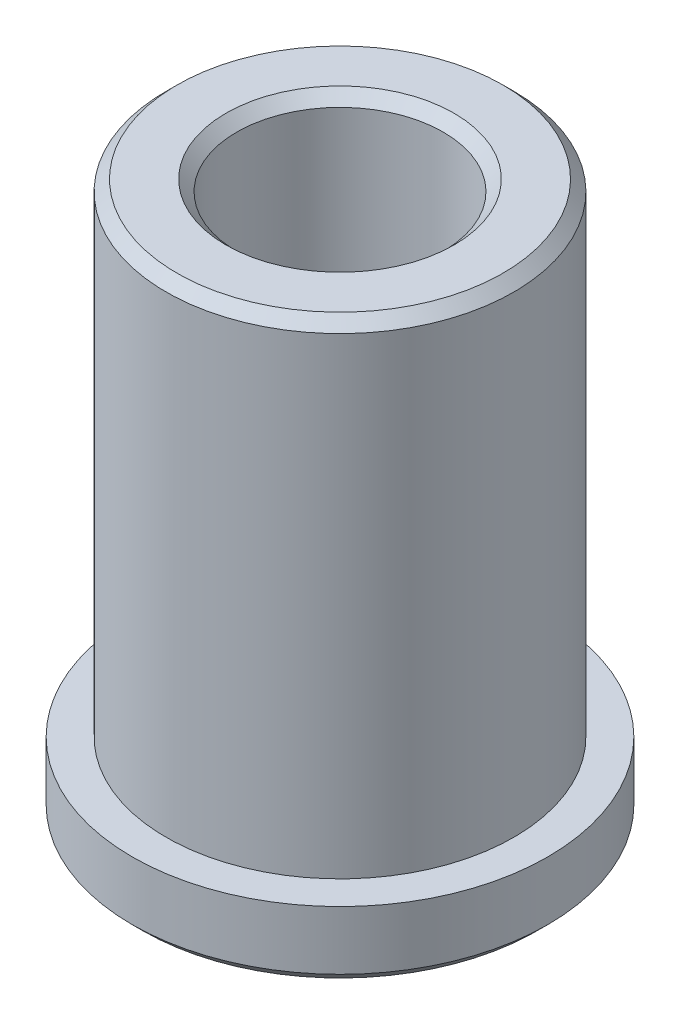
from build123d import *

# Parameters (mm, degrees)
CHAMFER1_SIZE = 0.25


with BuildPart() as part:
    # Sketch1 → Revolve1 (revolve)
    with BuildSketch(Plane.XY):
        Polygon((-2.375, 0), (-2.375, 12.7125), (-4, 12.7125), (-4, 1.6), (-4.78, 1.6), (-4.78, 0), align=None)
    revolve(axis=Axis((0, 0, 0), (0, 1, 0)))

    # Chamfer1
    chamfer1_edges = [part.edges().sort_by_distance(p)[0] for p in [
        (4.78, 0, 0),
        (2.375, 0, 0),
        (2.375, 12.7125, 0),
        (4, 12.7125, 0),
    ]]
    chamfer(chamfer1_edges, length=CHAMFER1_SIZE)


solid = part.part
